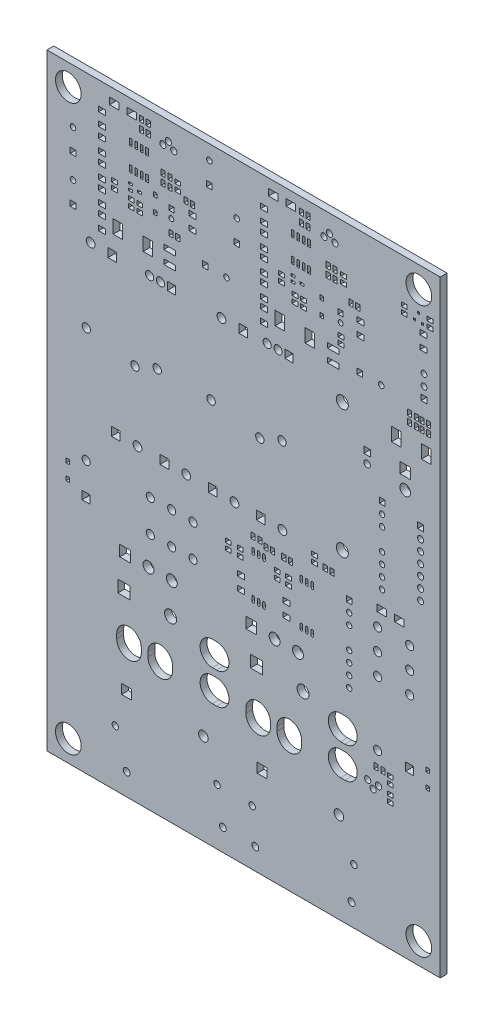
from build123d import *

# Parameters (mm, degrees)
MODEL_R            = 3
MODEL_R_2          = 0.79995
MODEL_R_3          = 0.75
MODEL_W            = 2.25
MODEL_H            = 2.25
MODEL_R_4          = 1.125
MODEL_W_2          = 2.8
MODEL_H_2          = 2.8
MODEL_W_3          = 2.55
MODEL_H_3          = 2.55
MODEL_W_4          = 0.8
MODEL_H_4          = 1
MODEL_W_5          = 1.9
MODEL_H_5          = 1.9
MODEL_R_5          = 0.95
MODEL_R_6          = 1.4
MODEL_R_7          = 1.275
MODEL_W_6          = 1.65
MODEL_H_6          = 1.15
MODEL_W_7          = 1.35
MODEL_H_7          = 0.95
MODEL_R_8          = 0.725
MODEL_W_8          = 0.95
MODEL_H_8          = 1.35
MODEL_R_9          = 0.625
MODEL_W_9          = 1.25
MODEL_H_9          = 1.25
MODEL_W_10         = 2.2
MODEL_H_10         = 1.55
MODEL_W_11         = 2.05
MODEL_H_11         = 2.05
MODEL_R_10         = 1.025
MODEL_R_11         = 0.975
MODEL_W_12         = 1.3
MODEL_H_12         = 1.3
MODEL_R_12         = 0.65
MODEL_H_13         = 3.15
MODEL_W_13         = 0.85
MODEL_H_14         = 0.55
MODEL_W_14         = 0.6
MODEL_W_15         = 2.7
MODEL_R_13         = 0.575
MODEL_W_16         = 1.15
MODEL_R_14         = 0.7
MODEL_W_17         = 1.5
MODEL_H_15         = 1.5
MODEL_R_15         = 1.25
MODEL_W_18         = 1.4
MODEL_H_16         = 1.4
MODEL_W_19         = 2.5
MODEL_H_17         = 2.5
MODEL_R_16         = 0.675
MODEL_W_20         = 0.4318
MODEL_H_18         = 0.508
BOSS_EXTRU_1_DEPTH = 1.6


with BuildPart() as part:
    # Model → Boss.-Extru.1 (new body)
    with BuildSketch(Plane.XY):
        Polygon((0, 136), (0, 0), (91, 0), (92, 0), (92, 136), (92, 142), (0, 142), align=None)
        with Locations((5, 5)):
            Circle(MODEL_R, mode=Mode.SUBTRACT)
        with Locations((18.65, 5.1)):
            Circle(MODEL_R_2, mode=Mode.SUBTRACT)
        with Locations((16, 13.1)):
            Circle(MODEL_R_3, mode=Mode.SUBTRACT)
        with Locations((18.6, 21.3)):
            Rectangle(MODEL_W, MODEL_H, mode=Mode.SUBTRACT)
        with BuildLine():
            ThreePointArc((22.075, 30.9), (19.2, 28.025), (16.325, 30.9))
            Line((16.325, 30.9), (16.325, 31.9))
            ThreePointArc((16.325, 31.9), (19.2, 34.775), (22.075, 31.9))
            Line((22.075, 31.9), (22.075, 30.9))
        make_face(mode=Mode.SUBTRACT)
        with Locations((41.15, 5.1)):
            Circle(MODEL_R_2, mode=Mode.SUBTRACT)
        with Locations((39.8, 13.1)):
            Circle(MODEL_R_3, mode=Mode.SUBTRACT)
        with BuildLine():
            ThreePointArc((29.375, 30.9), (26.5, 28.025), (23.625, 30.9))
            Line((23.625, 30.9), (23.625, 31.9))
            ThreePointArc((23.625, 31.9), (26.5, 34.775), (29.375, 31.9))
            Line((29.375, 31.9), (29.375, 30.9))
        make_face(mode=Mode.SUBTRACT)
        with Locations((36.6, 21.3)):
            Circle(MODEL_R_4, mode=Mode.SUBTRACT)
        with BuildLine():
            ThreePointArc((39.7, 34.675), (42.575, 31.8), (39.7, 28.925))
            Line((39.7, 28.925), (38.7, 28.925))
            ThreePointArc((38.7, 28.925), (35.825, 31.8), (38.7, 34.675))
            Line((38.7, 34.675), (39.7, 34.675))
        make_face(mode=Mode.SUBTRACT)
        with Locations((18, 41.7)):
            Rectangle(MODEL_W_2, MODEL_H_2, mode=Mode.SUBTRACT)
        with Locations((18.3, 49.1)):
            Rectangle(MODEL_W_3, MODEL_H_3, mode=Mode.SUBTRACT)
        with Locations((4.9, 57.5)):
            Rectangle(MODEL_W_4, MODEL_H_4, mode=Mode.SUBTRACT)
        with Locations((4.9, 61.1)):
            Rectangle(MODEL_W_4, MODEL_H_4, mode=Mode.SUBTRACT)
        with Locations((9.18, 55.95)):
            Rectangle(MODEL_W_5, MODEL_H_5, mode=Mode.SUBTRACT)
        with Locations((9.18, 63.45)):
            Circle(MODEL_R_5, mode=Mode.SUBTRACT)
        with Locations((28.92, 41.7)):
            Circle(MODEL_R_6, mode=Mode.SUBTRACT)
        with Locations((23.76, 49.1)):
            Circle(MODEL_R_7, mode=Mode.SUBTRACT)
        with Locations((29.22, 49.1)):
            Circle(MODEL_R_7, mode=Mode.SUBTRACT)
        with BuildLine():
            ThreePointArc((39.7, 41.975), (42.575, 39.1), (39.7, 36.225))
            Line((39.7, 36.225), (38.7, 36.225))
            ThreePointArc((38.7, 36.225), (35.825, 39.1), (38.7, 41.975))
            Line((38.7, 41.975), (39.7, 41.975))
        make_face(mode=Mode.SUBTRACT)
        with Locations((24.18, 55.95)):
            Circle(MODEL_R_5, mode=Mode.SUBTRACT)
        with Locations((29.18, 55.95)):
            Circle(MODEL_R_5, mode=Mode.SUBTRACT)
        with Locations((34.18, 55.95)):
            Circle(MODEL_R_5, mode=Mode.SUBTRACT)
        with Locations((24.18, 63.45)):
            Circle(MODEL_R_5, mode=Mode.SUBTRACT)
        with Locations((29.18, 63.45)):
            Circle(MODEL_R_5, mode=Mode.SUBTRACT)
        with Locations((34.18, 63.45)):
            Circle(MODEL_R_5, mode=Mode.SUBTRACT)
        with Locations((45.4, 55.3)):
            Rectangle(MODEL_W_6, MODEL_H_6, mode=Mode.SUBTRACT)
        with Locations((42.4, 62)):
            Rectangle(MODEL_W_7, MODEL_H_7, mode=Mode.SUBTRACT)
        with Locations((45.4, 58.3)):
            Rectangle(MODEL_W_6, MODEL_H_6, mode=Mode.SUBTRACT)
        with Locations((45.2, 62)):
            Rectangle(MODEL_W_7, MODEL_H_7, mode=Mode.SUBTRACT)
        with Locations((42.4, 63.6)):
            Rectangle(MODEL_W_7, MODEL_H_7, mode=Mode.SUBTRACT)
        with Locations((45.2, 63.6)):
            Rectangle(MODEL_W_7, MODEL_H_7, mode=Mode.SUBTRACT)
        with Locations((48.75, 5)):
            Circle(MODEL_R_2, mode=Mode.SUBTRACT)
        with Locations((48, 12.9)):
            Circle(MODEL_R_3, mode=Mode.SUBTRACT)
        with Locations((50.3, 21.2)):
            Rectangle(MODEL_W, MODEL_H, mode=Mode.SUBTRACT)
        with BuildLine():
            ThreePointArc((52.275, 30.9), (49.4, 28.025), (46.525, 30.9))
            Line((46.525, 30.9), (46.525, 31.9))
            ThreePointArc((46.525, 31.9), (49.4, 34.775), (52.275, 31.9))
            Line((52.275, 31.9), (52.275, 30.9))
        make_face(mode=Mode.SUBTRACT)
        with BuildLine():
            ThreePointArc((59.575, 30.9), (56.7, 28.025), (53.825, 30.9))
            Line((53.825, 30.9), (53.825, 31.9))
            ThreePointArc((53.825, 31.9), (56.7, 34.775), (59.575, 31.9))
            Line((59.575, 31.9), (59.575, 30.9))
        make_face(mode=Mode.SUBTRACT)
        with Locations((68.3, 21.2)):
            Circle(MODEL_R_4, mode=Mode.SUBTRACT)
        with Locations((71.25, 5)):
            Circle(MODEL_R_2, mode=Mode.SUBTRACT)
        with Locations((71.8, 12.9)):
            Circle(MODEL_R_3, mode=Mode.SUBTRACT)
        with Locations((87, 5)):
            Circle(MODEL_R, mode=Mode.SUBTRACT)
        with BuildLine():
            ThreePointArc((69.7, 34.675), (72.575, 31.8), (69.7, 28.925))
            Line((69.7, 28.925), (68.7, 28.925))
            ThreePointArc((68.7, 28.925), (65.825, 31.8), (68.7, 34.675))
            Line((68.7, 34.675), (69.7, 34.675))
        make_face(mode=Mode.SUBTRACT)
        with Locations((76.3, 30.43)):
            Circle(MODEL_R_8, mode=Mode.SUBTRACT)
        with Locations((80.3, 29.7)):
            Rectangle(MODEL_W_7, MODEL_H_7, mode=Mode.SUBTRACT)
        with Locations((75.03, 31.7)):
            Circle(MODEL_R_8, mode=Mode.SUBTRACT)
        with Locations((77.57, 31.7)):
            Circle(MODEL_R_8, mode=Mode.SUBTRACT)
        with Locations((77, 35.3)):
            Rectangle(MODEL_W_8, MODEL_H_8, mode=Mode.SUBTRACT)
        with Locations((80.3, 31.3)):
            Rectangle(MODEL_W_7, MODEL_H_7, mode=Mode.SUBTRACT)
        with Locations((78.6, 35.3)):
            Rectangle(MODEL_W_8, MODEL_H_8, mode=Mode.SUBTRACT)
        with Locations((80.3, 33.4)):
            Rectangle(MODEL_W_7, MODEL_H_7, mode=Mode.SUBTRACT)
        with Locations((80.3, 35)):
            Rectangle(MODEL_W_7, MODEL_H_7, mode=Mode.SUBTRACT)
        with Locations((49, 42)):
            Rectangle(MODEL_W_2, MODEL_H_2, mode=Mode.SUBTRACT)
        with Locations((47.8, 49.3)):
            Rectangle(MODEL_W_3, MODEL_H_3, mode=Mode.SUBTRACT)
        with Locations((53.26, 49.3)):
            Circle(MODEL_R_7, mode=Mode.SUBTRACT)
        with Locations((59.92, 42)):
            Circle(MODEL_R_6, mode=Mode.SUBTRACT)
        with Locations((58.72, 49.3)):
            Circle(MODEL_R_7, mode=Mode.SUBTRACT)
        with BuildLine():
            ThreePointArc((48.53, 54.375), (48.23, 54.075), (47.93, 54.375))
            Line((47.93, 54.375), (47.93, 55.325))
            ThreePointArc((47.93, 55.325), (48.23, 55.625), (48.53, 55.325))
            Line((48.53, 55.325), (48.53, 54.375))
        make_face(mode=Mode.SUBTRACT)
        with BuildLine():
            ThreePointArc((49.8, 54.375), (49.5, 54.075), (49.2, 54.375))
            Line((49.2, 54.375), (49.2, 55.325))
            ThreePointArc((49.2, 55.325), (49.5, 55.625), (49.8, 55.325))
            Line((49.8, 55.325), (49.8, 54.375))
        make_face(mode=Mode.SUBTRACT)
        with BuildLine():
            ThreePointArc((51.07, 54.375), (50.77, 54.075), (50.47, 54.375))
            Line((50.47, 54.375), (50.47, 55.325))
            ThreePointArc((50.47, 55.325), (50.77, 55.625), (51.07, 55.325))
            Line((51.07, 55.325), (51.07, 54.375))
        make_face(mode=Mode.SUBTRACT)
        with Locations((56, 55.2)):
            Rectangle(MODEL_W_6, MODEL_H_6, mode=Mode.SUBTRACT)
        with Locations((53.9, 61.8)):
            Rectangle(MODEL_W_7, MODEL_H_7, mode=Mode.SUBTRACT)
        with Locations((56, 58.2)):
            Rectangle(MODEL_W_6, MODEL_H_6, mode=Mode.SUBTRACT)
        with Locations((56.5, 61.8)):
            Rectangle(MODEL_W_7, MODEL_H_7, mode=Mode.SUBTRACT)
        with BuildLine():
            ThreePointArc((48.53, 64.075), (48.23, 63.775), (47.93, 64.075))
            Line((47.93, 64.075), (47.93, 65.025))
            ThreePointArc((47.93, 65.025), (48.23, 65.325), (48.53, 65.025))
            Line((48.53, 65.025), (48.53, 64.075))
        make_face(mode=Mode.SUBTRACT)
        with BuildLine():
            ThreePointArc((49.8, 64.075), (49.5, 63.775), (49.2, 64.075))
            Line((49.2, 64.075), (49.2, 65.025))
            ThreePointArc((49.2, 65.025), (49.5, 65.325), (49.8, 65.025))
            Line((49.8, 65.025), (49.8, 64.075))
        make_face(mode=Mode.SUBTRACT)
        with BuildLine():
            ThreePointArc((51.07, 64.075), (50.77, 63.775), (50.47, 64.075))
            Line((50.47, 64.075), (50.47, 65.025))
            ThreePointArc((50.47, 65.025), (50.77, 65.325), (51.07, 65.025))
            Line((51.07, 65.025), (51.07, 64.075))
        make_face(mode=Mode.SUBTRACT)
        with Locations((48.2, 67.6)):
            Rectangle(MODEL_W_8, MODEL_H_8, mode=Mode.SUBTRACT)
        with Locations((49.8, 67.6)):
            Rectangle(MODEL_W_8, MODEL_H_8, mode=Mode.SUBTRACT)
        with Locations((51.2, 66.9)):
            Rectangle(MODEL_W_8, MODEL_H_8, mode=Mode.SUBTRACT)
        with Locations((53.9, 63.4)):
            Rectangle(MODEL_W_7, MODEL_H_7, mode=Mode.SUBTRACT)
        with Locations((56.5, 63.4)):
            Rectangle(MODEL_W_7, MODEL_H_7, mode=Mode.SUBTRACT)
        with Locations((52.8, 66.9)):
            Rectangle(MODEL_W_8, MODEL_H_8, mode=Mode.SUBTRACT)
        with Locations((55.4, 66.9)):
            Rectangle(MODEL_W_8, MODEL_H_8, mode=Mode.SUBTRACT)
        with Locations((57, 66.9)):
            Rectangle(MODEL_W_8, MODEL_H_8, mode=Mode.SUBTRACT)
        with BuildLine():
            ThreePointArc((59.83, 54.375), (59.53, 54.075), (59.23, 54.375))
            Line((59.23, 54.375), (59.23, 55.325))
            ThreePointArc((59.23, 55.325), (59.53, 55.625), (59.83, 55.325))
            Line((59.83, 55.325), (59.83, 54.375))
        make_face(mode=Mode.SUBTRACT)
        with BuildLine():
            ThreePointArc((61.1, 54.375), (60.8, 54.075), (60.5, 54.375))
            Line((60.5, 54.375), (60.5, 55.325))
            ThreePointArc((60.5, 55.325), (60.8, 55.625), (61.1, 55.325))
            Line((61.1, 55.325), (61.1, 54.375))
        make_face(mode=Mode.SUBTRACT)
        with BuildLine():
            ThreePointArc((62.37, 54.375), (62.07, 54.075), (61.77, 54.375))
            Line((61.77, 54.375), (61.77, 55.325))
            ThreePointArc((61.77, 55.325), (62.07, 55.625), (62.37, 55.325))
            Line((62.37, 55.325), (62.37, 54.375))
        make_face(mode=Mode.SUBTRACT)
        with BuildLine():
            ThreePointArc((59.83, 64.075), (59.53, 63.775), (59.23, 64.075))
            Line((59.23, 64.075), (59.23, 65.025))
            ThreePointArc((59.23, 65.025), (59.53, 65.325), (59.83, 65.025))
            Line((59.83, 65.025), (59.83, 64.075))
        make_face(mode=Mode.SUBTRACT)
        with BuildLine():
            ThreePointArc((61.1, 64.075), (60.8, 63.775), (60.5, 64.075))
            Line((60.5, 64.075), (60.5, 65.025))
            ThreePointArc((60.5, 65.025), (60.8, 65.325), (61.1, 65.025))
            Line((61.1, 65.025), (61.1, 64.075))
        make_face(mode=Mode.SUBTRACT)
        with BuildLine():
            ThreePointArc((62.37, 64.075), (62.07, 63.775), (61.77, 64.075))
            Line((61.77, 64.075), (61.77, 65.025))
            ThreePointArc((61.77, 65.025), (62.07, 65.325), (62.37, 65.025))
            Line((62.37, 65.025), (62.37, 64.075))
        make_face(mode=Mode.SUBTRACT)
        with Locations((62.6, 69.4)):
            Rectangle(MODEL_W_7, MODEL_H_7, mode=Mode.SUBTRACT)
        with Locations((62.6, 71)):
            Rectangle(MODEL_W_7, MODEL_H_7, mode=Mode.SUBTRACT)
        with Locations((65.1, 69.6)):
            Rectangle(MODEL_W_8, MODEL_H_8, mode=Mode.SUBTRACT)
        with Locations((66.7, 69.6)):
            Rectangle(MODEL_W_8, MODEL_H_8, mode=Mode.SUBTRACT)
        with BuildLine():
            ThreePointArc((69.7, 41.975), (72.575, 39.1), (69.7, 36.225))
            Line((69.7, 36.225), (68.7, 36.225))
            ThreePointArc((68.7, 36.225), (65.825, 39.1), (68.7, 41.975))
            Line((68.7, 41.975), (69.7, 41.975))
        make_face(mode=Mode.SUBTRACT)
        with Locations((77.35, 38.78)):
            Circle(MODEL_R_5, mode=Mode.SUBTRACT)
        with Locations((70.7, 48.12)):
            Circle(MODEL_R_9, mode=Mode.SUBTRACT)
        with Locations((70.7, 50.66)):
            Circle(MODEL_R_9, mode=Mode.SUBTRACT)
        with Locations((70.7, 53.2)):
            Circle(MODEL_R_9, mode=Mode.SUBTRACT)
        with Locations((84.85, 38.78)):
            Rectangle(MODEL_W_5, MODEL_H_5, mode=Mode.SUBTRACT)
        with Locations((89.1, 37)):
            Rectangle(MODEL_W_4, MODEL_H_4, mode=Mode.SUBTRACT)
        with Locations((89.1, 40.6)):
            Rectangle(MODEL_W_4, MODEL_H_4, mode=Mode.SUBTRACT)
        with Locations((70.7, 55.74)):
            Circle(MODEL_R_9, mode=Mode.SUBTRACT)
        with Locations((70.7, 60.82)):
            Circle(MODEL_R_9, mode=Mode.SUBTRACT)
        with Locations((77.35, 53.78)):
            Circle(MODEL_R_5, mode=Mode.SUBTRACT)
        with Locations((77.35, 58.78)):
            Circle(MODEL_R_5, mode=Mode.SUBTRACT)
        with Locations((70.7, 63.36)):
            Circle(MODEL_R_9, mode=Mode.SUBTRACT)
        with Locations((70.7, 65.9)):
            Rectangle(MODEL_W_9, MODEL_H_9, mode=Mode.SUBTRACT)
        with Locations((77.35, 63.78)):
            Circle(MODEL_R_5, mode=Mode.SUBTRACT)
        with Locations((78.35, 67.6)):
            Rectangle(MODEL_W_10, MODEL_H_10, mode=Mode.SUBTRACT)
        with Locations((84.85, 53.78)):
            Circle(MODEL_R_5, mode=Mode.SUBTRACT)
        with Locations((84.85, 58.78)):
            Circle(MODEL_R_5, mode=Mode.SUBTRACT)
        with Locations((84.85, 63.78)):
            Circle(MODEL_R_5, mode=Mode.SUBTRACT)
        with Locations((82.45, 67.6)):
            Rectangle(MODEL_W_10, MODEL_H_10, mode=Mode.SUBTRACT)
        with Locations((16.1, 72.3)):
            Rectangle(MODEL_W_11, MODEL_H_11, mode=Mode.SUBTRACT)
        with Locations((21.18, 72.3)):
            Circle(MODEL_R_10, mode=Mode.SUBTRACT)
        with Locations((20.6, 88.281)):
            Circle(MODEL_R_11, mode=Mode.SUBTRACT)
        with Locations((9.21, 90.3)):
            Circle(MODEL_R_11, mode=Mode.SUBTRACT)
        with Locations((27.5, 72.3)):
            Rectangle(MODEL_W_11, MODEL_H_11, mode=Mode.SUBTRACT)
        with Locations((32.58, 72.3)):
            Circle(MODEL_R_10, mode=Mode.SUBTRACT)
        with Locations((38.8, 72.3)):
            Rectangle(MODEL_W_11, MODEL_H_11, mode=Mode.SUBTRACT)
        with Locations((43.88, 72.3)):
            Circle(MODEL_R_10, mode=Mode.SUBTRACT)
        with Locations((25.794, 90.3)):
            Circle(MODEL_R_11, mode=Mode.SUBTRACT)
        with Locations((38.41, 90.3)):
            Circle(MODEL_R_11, mode=Mode.SUBTRACT)
        with Locations((10.22, 108.1)):
            Circle(MODEL_R_10, mode=Mode.SUBTRACT)
        with Locations((6.1, 113.7)):
            Rectangle(MODEL_W_12, MODEL_H_12, mode=Mode.SUBTRACT)
        with Locations((6.1, 118.7)):
            Circle(MODEL_R_12, mode=Mode.SUBTRACT)
        with Locations((15.3, 108.1)):
            Rectangle(MODEL_W_11, MODEL_H_11, mode=Mode.SUBTRACT)
        with Locations((12.9, 112)):
            Rectangle(MODEL_W_6, MODEL_H_6, mode=Mode.SUBTRACT)
        with Locations((12.9, 115)):
            Rectangle(MODEL_W_6, MODEL_H_6, mode=Mode.SUBTRACT)
        with Locations((16.6, 114)):
            Rectangle(MODEL_W_10, MODEL_H_13, mode=Mode.SUBTRACT)
        with Locations((12.9, 117.2)):
            Rectangle(MODEL_W_6, MODEL_H_6, mode=Mode.SUBTRACT)
        with Locations((12.9, 120.2)):
            Rectangle(MODEL_W_6, MODEL_H_6, mode=Mode.SUBTRACT)
        with Locations((12.9, 122.4)):
            Rectangle(MODEL_W_6, MODEL_H_6, mode=Mode.SUBTRACT)
        with Locations((15.8, 121.7)):
            Rectangle(MODEL_W_7, MODEL_H_7, mode=Mode.SUBTRACT)
        with Locations((15.8, 123.3)):
            Rectangle(MODEL_W_7, MODEL_H_7, mode=Mode.SUBTRACT)
        with Locations((19.7, 120)):
            Rectangle(MODEL_W_7, MODEL_H_7, mode=Mode.SUBTRACT)
        with Locations((19.7, 121.6)):
            Rectangle(MODEL_W_7, MODEL_H_7, mode=Mode.SUBTRACT)
        with Locations((19.55, 123.35)):
            Rectangle(MODEL_W_13, MODEL_H_14, mode=Mode.SUBTRACT)
        with Locations((21.7, 120)):
            Rectangle(MODEL_W_7, MODEL_H_7, mode=Mode.SUBTRACT)
        with Locations((21.7, 121.6)):
            Rectangle(MODEL_W_7, MODEL_H_7, mode=Mode.SUBTRACT)
        with Locations((21.65, 124)):
            Rectangle(MODEL_W_13, MODEL_H_14, mode=Mode.SUBTRACT)
        with Locations((6.1, 124.4)):
            Rectangle(MODEL_W_12, MODEL_H_12, mode=Mode.SUBTRACT)
        with Locations((6.1, 129.4)):
            Circle(MODEL_R_12, mode=Mode.SUBTRACT)
        with Locations((5, 137)):
            Circle(MODEL_R, mode=Mode.SUBTRACT)
        with Locations((12.9, 125.4)):
            Rectangle(MODEL_W_6, MODEL_H_6, mode=Mode.SUBTRACT)
        with Locations((12.9, 127.7)):
            Rectangle(MODEL_W_6, MODEL_H_6, mode=Mode.SUBTRACT)
        with Locations((12.9, 130.7)):
            Rectangle(MODEL_W_6, MODEL_H_6, mode=Mode.SUBTRACT)
        with Locations((12.9, 133.1)):
            Rectangle(MODEL_W_6, MODEL_H_6, mode=Mode.SUBTRACT)
        with Locations((19.55, 124.65)):
            Rectangle(MODEL_W_13, MODEL_H_14, mode=Mode.SUBTRACT)
        with Locations((19.595, 127.7)):
            Rectangle(MODEL_W_14, MODEL_H_10, mode=Mode.SUBTRACT)
        with Locations((20.865, 127.7)):
            Rectangle(MODEL_W_14, MODEL_H_10, mode=Mode.SUBTRACT)
        with Locations((22.135, 127.7)):
            Rectangle(MODEL_W_14, MODEL_H_10, mode=Mode.SUBTRACT)
        with Locations((19.595, 133.1)):
            Rectangle(MODEL_W_14, MODEL_H_10, mode=Mode.SUBTRACT)
        with Locations((20.865, 133.1)):
            Rectangle(MODEL_W_14, MODEL_H_10, mode=Mode.SUBTRACT)
        with Locations((22.135, 133.1)):
            Rectangle(MODEL_W_14, MODEL_H_10, mode=Mode.SUBTRACT)
        with Locations((12.9, 136.1)):
            Rectangle(MODEL_W_6, MODEL_H_6, mode=Mode.SUBTRACT)
        with Locations((15.75, 139)):
            Rectangle(MODEL_W_10, MODEL_H_10, mode=Mode.SUBTRACT)
        with Locations((22.1, 136.9)):
            Rectangle(MODEL_W_8, MODEL_H_8, mode=Mode.SUBTRACT)
        with Locations((19.85, 139)):
            Rectangle(MODEL_W_10, MODEL_H_10, mode=Mode.SUBTRACT)
        with Locations((22.1, 139)):
            Rectangle(MODEL_W_8, MODEL_H_8, mode=Mode.SUBTRACT)
        with Locations((24.02, 108.3)):
            Circle(MODEL_R_5, mode=Mode.SUBTRACT)
        with Locations((26.56, 108.3)):
            Circle(MODEL_R_5, mode=Mode.SUBTRACT)
        with Locations((23.6, 114)):
            Rectangle(MODEL_W_10, MODEL_H_13, mode=Mode.SUBTRACT)
        with Locations((28.7, 112.8)):
            Rectangle(MODEL_W_15, MODEL_H_6, mode=Mode.SUBTRACT)
        with Locations((29.1, 108.3)):
            Rectangle(MODEL_W_5, MODEL_H_5, mode=Mode.SUBTRACT)
        with Locations((28.7, 115.8)):
            Rectangle(MODEL_W_15, MODEL_H_6, mode=Mode.SUBTRACT)
        with Locations((25.3, 121.7)):
            Rectangle(MODEL_W_4, MODEL_H_4, mode=Mode.SUBTRACT)
        with Locations((29, 119.3)):
            Rectangle(MODEL_W_8, MODEL_H_8, mode=Mode.SUBTRACT)
        with Locations((30.6, 119.3)):
            Rectangle(MODEL_W_8, MODEL_H_8, mode=Mode.SUBTRACT)
        with Locations((29.1, 122.4)):
            Circle(MODEL_R_13, mode=Mode.SUBTRACT)
        with Locations((34.1, 122.6)):
            Rectangle(MODEL_W_6, MODEL_H_6, mode=Mode.SUBTRACT)
        with Locations((40.82, 108.1)):
            Circle(MODEL_R_10, mode=Mode.SUBTRACT)
        with Locations((45.9, 108.1)):
            Rectangle(MODEL_W_11, MODEL_H_11, mode=Mode.SUBTRACT)
        with Locations((37, 116.9)):
            Rectangle(MODEL_W_12, MODEL_H_12, mode=Mode.SUBTRACT)
        with Locations((42, 116.9)):
            Circle(MODEL_R_12, mode=Mode.SUBTRACT)
        with Locations((25.3, 125.3)):
            Rectangle(MODEL_W_4, MODEL_H_4, mode=Mode.SUBTRACT)
        with Locations((23.405, 127.7)):
            Rectangle(MODEL_W_14, MODEL_H_10, mode=Mode.SUBTRACT)
        with Locations((27.2, 128.6)):
            Rectangle(MODEL_W_8, MODEL_H_8, mode=Mode.SUBTRACT)
        with Locations((23.405, 133.1)):
            Rectangle(MODEL_W_14, MODEL_H_10, mode=Mode.SUBTRACT)
        with Locations((27.2, 130.6)):
            Rectangle(MODEL_W_8, MODEL_H_8, mode=Mode.SUBTRACT)
        with Locations((29.1, 124.4)):
            Rectangle(MODEL_W_16, MODEL_H_6, mode=Mode.SUBTRACT)
        with Locations((28.8, 128.6)):
            Rectangle(MODEL_W_8, MODEL_H_8, mode=Mode.SUBTRACT)
        with Locations((34.1, 125.6)):
            Rectangle(MODEL_W_6, MODEL_H_6, mode=Mode.SUBTRACT)
        with Locations((32.5, 127.7)):
            Rectangle(MODEL_W_8, MODEL_H_8, mode=Mode.SUBTRACT)
        with Locations((34.1, 127.7)):
            Rectangle(MODEL_W_8, MODEL_H_8, mode=Mode.SUBTRACT)
        with Locations((28.8, 130.6)):
            Rectangle(MODEL_W_8, MODEL_H_8, mode=Mode.SUBTRACT)
        with Locations((30.6, 128.8)):
            Rectangle(MODEL_W_7, MODEL_H_7, mode=Mode.SUBTRACT)
        with Locations((30.6, 130.4)):
            Rectangle(MODEL_W_7, MODEL_H_7, mode=Mode.SUBTRACT)
        with Locations((23.7, 136.9)):
            Rectangle(MODEL_W_8, MODEL_H_8, mode=Mode.SUBTRACT)
        with Locations((27.13, 136.4)):
            Circle(MODEL_R_8, mode=Mode.SUBTRACT)
        with Locations((23.7, 139)):
            Rectangle(MODEL_W_8, MODEL_H_8, mode=Mode.SUBTRACT)
        with Locations((28.4, 137.67)):
            Circle(MODEL_R_8, mode=Mode.SUBTRACT)
        with Locations((29.67, 136.4)):
            Circle(MODEL_R_8, mode=Mode.SUBTRACT)
        with Locations((44.4, 125.1)):
            Rectangle(MODEL_W_12, MODEL_H_12, mode=Mode.SUBTRACT)
        with Locations((44.4, 130.1)):
            Circle(MODEL_R_12, mode=Mode.SUBTRACT)
        with Locations((38, 133.6)):
            Rectangle(MODEL_W_12, MODEL_H_12, mode=Mode.SUBTRACT)
        with Locations((38, 138.6)):
            Circle(MODEL_R_12, mode=Mode.SUBTRACT)
        with Locations((50, 72.3)):
            Rectangle(MODEL_W_11, MODEL_H_11, mode=Mode.SUBTRACT)
        with Locations((55.08, 72.3)):
            Circle(MODEL_R_10, mode=Mode.SUBTRACT)
        with Locations((49.8, 88.281)):
            Circle(MODEL_R_11, mode=Mode.SUBTRACT)
        with Locations((54.994, 90.3)):
            Circle(MODEL_R_11, mode=Mode.SUBTRACT)
        with Locations((69.1, 75.2)):
            Circle(MODEL_R_6, mode=Mode.SUBTRACT)
        with Locations((78.4, 71.92)):
            Circle(MODEL_R_9, mode=Mode.SUBTRACT)
        with Locations((78.4, 74.46)):
            Circle(MODEL_R_9, mode=Mode.SUBTRACT)
        with Locations((78.4, 77)):
            Circle(MODEL_R_9, mode=Mode.SUBTRACT)
        with Locations((78.4, 79.54)):
            Circle(MODEL_R_9, mode=Mode.SUBTRACT)
        with Locations((78.4, 84.62)):
            Circle(MODEL_R_9, mode=Mode.SUBTRACT)
        with Locations((78.4, 87.16)):
            Circle(MODEL_R_9, mode=Mode.SUBTRACT)
        with Locations((87.4, 74.1)):
            Circle(MODEL_R_14, mode=Mode.SUBTRACT)
        with Locations((87.4, 76.6)):
            Circle(MODEL_R_14, mode=Mode.SUBTRACT)
        with Locations((87.4, 79.1)):
            Circle(MODEL_R_14, mode=Mode.SUBTRACT)
        with Locations((87.4, 81.6)):
            Circle(MODEL_R_14, mode=Mode.SUBTRACT)
        with Locations((87.4, 84.1)):
            Circle(MODEL_R_14, mode=Mode.SUBTRACT)
        with Locations((87.4, 86.6)):
            Circle(MODEL_R_14, mode=Mode.SUBTRACT)
        with Locations((78.4, 89.7)):
            Rectangle(MODEL_W_9, MODEL_H_9, mode=Mode.SUBTRACT)
        with Locations((74.9, 95.6)):
            Circle(MODEL_R_3, mode=Mode.SUBTRACT)
        with Locations((69.1, 105.2)):
            Circle(MODEL_R_6, mode=Mode.SUBTRACT)
        with Locations((74.9, 98.1)):
            Rectangle(MODEL_W_17, MODEL_H_15, mode=Mode.SUBTRACT)
        with Locations((83.8, 94.74)):
            Circle(MODEL_R_15, mode=Mode.SUBTRACT)
        with Locations((87.4, 89.1)):
            Rectangle(MODEL_W_18, MODEL_H_16, mode=Mode.SUBTRACT)
        with Locations((83.8, 98.7)):
            Rectangle(MODEL_W_19, MODEL_H_17, mode=Mode.SUBTRACT)
        with Locations((81.7, 104.5)):
            Rectangle(MODEL_W_10, MODEL_H_13, mode=Mode.SUBTRACT)
        with Locations((88.7, 104.5)):
            Rectangle(MODEL_W_10, MODEL_H_13, mode=Mode.SUBTRACT)
        with Locations((51.52, 108.3)):
            Circle(MODEL_R_5, mode=Mode.SUBTRACT)
        with Locations((50.8, 112.1)):
            Rectangle(MODEL_W_6, MODEL_H_6, mode=Mode.SUBTRACT)
        with Locations((50.8, 115.1)):
            Rectangle(MODEL_W_6, MODEL_H_6, mode=Mode.SUBTRACT)
        with Locations((54.06, 108.3)):
            Circle(MODEL_R_5, mode=Mode.SUBTRACT)
        with Locations((56.6, 108.3)):
            Rectangle(MODEL_W_5, MODEL_H_5, mode=Mode.SUBTRACT)
        with Locations((54.5, 114.4)):
            Rectangle(MODEL_W_10, MODEL_H_13, mode=Mode.SUBTRACT)
        with Locations((50.8, 117.1)):
            Rectangle(MODEL_W_6, MODEL_H_6, mode=Mode.SUBTRACT)
        with Locations((50.8, 120.1)):
            Rectangle(MODEL_W_6, MODEL_H_6, mode=Mode.SUBTRACT)
        with Locations((50.8, 122.2)):
            Rectangle(MODEL_W_6, MODEL_H_6, mode=Mode.SUBTRACT)
        with Locations((54.9, 122.4)):
            Rectangle(MODEL_W_7, MODEL_H_7, mode=Mode.SUBTRACT)
        with Locations((54.9, 124)):
            Rectangle(MODEL_W_7, MODEL_H_7, mode=Mode.SUBTRACT)
        with Locations((61.5, 114.4)):
            Rectangle(MODEL_W_10, MODEL_H_13, mode=Mode.SUBTRACT)
        with Locations((67, 112)):
            Rectangle(MODEL_W_15, MODEL_H_6, mode=Mode.SUBTRACT)
        with Locations((67, 115)):
            Rectangle(MODEL_W_15, MODEL_H_6, mode=Mode.SUBTRACT)
        with Locations((58, 119.8)):
            Rectangle(MODEL_W_7, MODEL_H_7, mode=Mode.SUBTRACT)
        with Locations((60, 119.8)):
            Rectangle(MODEL_W_7, MODEL_H_7, mode=Mode.SUBTRACT)
        with Locations((58, 121.4)):
            Rectangle(MODEL_W_7, MODEL_H_7, mode=Mode.SUBTRACT)
        with Locations((60, 121.4)):
            Rectangle(MODEL_W_7, MODEL_H_7, mode=Mode.SUBTRACT)
        with Locations((57.55, 123.75)):
            Rectangle(MODEL_W_13, MODEL_H_14, mode=Mode.SUBTRACT)
        with Locations((68.8, 116.8)):
            Rectangle(MODEL_W_7, MODEL_H_7, mode=Mode.SUBTRACT)
        with Locations((68.8, 118.4)):
            Rectangle(MODEL_W_7, MODEL_H_7, mode=Mode.SUBTRACT)
        with Locations((64.3, 120.3)):
            Rectangle(MODEL_W_4, MODEL_H_4, mode=Mode.SUBTRACT)
        with Locations((64.3, 123.9)):
            Rectangle(MODEL_W_4, MODEL_H_4, mode=Mode.SUBTRACT)
        with Locations((68.7, 121.1)):
            Circle(MODEL_R_13, mode=Mode.SUBTRACT)
        with Locations((68.7, 123.1)):
            Rectangle(MODEL_W_16, MODEL_H_6, mode=Mode.SUBTRACT)
        with Locations((50.8, 125.2)):
            Rectangle(MODEL_W_6, MODEL_H_6, mode=Mode.SUBTRACT)
        with Locations((50.8, 127.2)):
            Rectangle(MODEL_W_6, MODEL_H_6, mode=Mode.SUBTRACT)
        with Locations((50.8, 130.2)):
            Rectangle(MODEL_W_6, MODEL_H_6, mode=Mode.SUBTRACT)
        with Locations((50.8, 132.4)):
            Rectangle(MODEL_W_6, MODEL_H_6, mode=Mode.SUBTRACT)
        with Locations((57.495, 128.1)):
            Rectangle(MODEL_W_14, MODEL_H_10, mode=Mode.SUBTRACT)
        with Locations((50.8, 135.4)):
            Rectangle(MODEL_W_6, MODEL_H_6, mode=Mode.SUBTRACT)
        with Locations((57.495, 133.5)):
            Rectangle(MODEL_W_14, MODEL_H_10, mode=Mode.SUBTRACT)
        with Locations((52.95, 139.1)):
            Rectangle(MODEL_W_10, MODEL_H_10, mode=Mode.SUBTRACT)
        with Locations((57.05, 139.1)):
            Rectangle(MODEL_W_10, MODEL_H_10, mode=Mode.SUBTRACT)
        with Locations((57.55, 125.05)):
            Rectangle(MODEL_W_13, MODEL_H_14, mode=Mode.SUBTRACT)
        with Locations((59.65, 124.4)):
            Rectangle(MODEL_W_13, MODEL_H_14, mode=Mode.SUBTRACT)
        with Locations((58.765, 128.1)):
            Rectangle(MODEL_W_14, MODEL_H_10, mode=Mode.SUBTRACT)
        with Locations((60.035, 128.1)):
            Rectangle(MODEL_W_14, MODEL_H_10, mode=Mode.SUBTRACT)
        with Locations((61.305, 128.1)):
            Rectangle(MODEL_W_14, MODEL_H_10, mode=Mode.SUBTRACT)
        with Locations((65.8, 129.2)):
            Rectangle(MODEL_W_8, MODEL_H_8, mode=Mode.SUBTRACT)
        with Locations((65.8, 131.2)):
            Rectangle(MODEL_W_8, MODEL_H_8, mode=Mode.SUBTRACT)
        with Locations((67.4, 129.2)):
            Rectangle(MODEL_W_8, MODEL_H_8, mode=Mode.SUBTRACT)
        with Locations((67.4, 131.2)):
            Rectangle(MODEL_W_8, MODEL_H_8, mode=Mode.SUBTRACT)
        with Locations((58.765, 133.5)):
            Rectangle(MODEL_W_14, MODEL_H_10, mode=Mode.SUBTRACT)
        with Locations((60.035, 133.5)):
            Rectangle(MODEL_W_14, MODEL_H_10, mode=Mode.SUBTRACT)
        with Locations((59.5, 136.7)):
            Rectangle(MODEL_W_8, MODEL_H_8, mode=Mode.SUBTRACT)
        with Locations((61.305, 133.5)):
            Rectangle(MODEL_W_14, MODEL_H_10, mode=Mode.SUBTRACT)
        with Locations((61.1, 136.7)):
            Rectangle(MODEL_W_8, MODEL_H_8, mode=Mode.SUBTRACT)
        with Locations((59.5, 138.9)):
            Rectangle(MODEL_W_8, MODEL_H_8, mode=Mode.SUBTRACT)
        with Locations((61.1, 138.9)):
            Rectangle(MODEL_W_8, MODEL_H_8, mode=Mode.SUBTRACT)
        with Locations((64.83, 136.6)):
            Circle(MODEL_R_8, mode=Mode.SUBTRACT)
        with Locations((67.37, 136.6)):
            Circle(MODEL_R_8, mode=Mode.SUBTRACT)
        with Locations((66.1, 137.87)):
            Circle(MODEL_R_8, mode=Mode.SUBTRACT)
        with Locations((73.2, 113.2)):
            Rectangle(MODEL_W_12, MODEL_H_12, mode=Mode.SUBTRACT)
        with Locations((78.2, 113.2)):
            Circle(MODEL_R_12, mode=Mode.SUBTRACT)
        with Locations((73.4, 120.7)):
            Rectangle(MODEL_W_6, MODEL_H_6, mode=Mode.SUBTRACT)
        with Locations((73.4, 123.7)):
            Rectangle(MODEL_W_6, MODEL_H_6, mode=Mode.SUBTRACT)
        with Locations((84.8, 108.9)):
            Rectangle(MODEL_W_8, MODEL_H_8, mode=Mode.SUBTRACT)
        with Locations((84.8, 110.8)):
            Rectangle(MODEL_W_8, MODEL_H_8, mode=Mode.SUBTRACT)
        with Locations((86.4, 108.9)):
            Rectangle(MODEL_W_8, MODEL_H_8, mode=Mode.SUBTRACT)
        with Locations((86.4, 110.8)):
            Rectangle(MODEL_W_8, MODEL_H_8, mode=Mode.SUBTRACT)
        with Locations((87.7, 108.9)):
            Rectangle(MODEL_W_8, MODEL_H_8, mode=Mode.SUBTRACT)
        with Locations((87.7, 110.8)):
            Rectangle(MODEL_W_8, MODEL_H_8, mode=Mode.SUBTRACT)
        with Locations((89.3, 108.9)):
            Rectangle(MODEL_W_8, MODEL_H_8, mode=Mode.SUBTRACT)
        with Locations((89.3, 110.8)):
            Rectangle(MODEL_W_8, MODEL_H_8, mode=Mode.SUBTRACT)
        with Locations((88.2, 115.4)):
            Rectangle(MODEL_W_7, MODEL_H_8, mode=Mode.SUBTRACT)
        with Locations((88.2, 117.94)):
            Circle(MODEL_R_16, mode=Mode.SUBTRACT)
        with Locations((88.2, 120.48)):
            Circle(MODEL_R_16, mode=Mode.SUBTRACT)
        with Locations((71.1, 126.3)):
            Rectangle(MODEL_W_8, MODEL_H_8, mode=Mode.SUBTRACT)
        with Locations((72.7, 126.3)):
            Rectangle(MODEL_W_8, MODEL_H_8, mode=Mode.SUBTRACT)
        with Locations((69.4, 129.4)):
            Rectangle(MODEL_W_7, MODEL_H_7, mode=Mode.SUBTRACT)
        with Locations((69.4, 131)):
            Rectangle(MODEL_W_7, MODEL_H_7, mode=Mode.SUBTRACT)
        with Locations((83.6, 130.4)):
            Rectangle(MODEL_W_7, MODEL_H_7, mode=Mode.SUBTRACT)
        with Locations((85.9602, 130.411)):
            Rectangle(MODEL_W_20, MODEL_H_18, mode=Mode.SUBTRACT)
        with Locations((83.6, 132)):
            Rectangle(MODEL_W_7, MODEL_H_7, mode=Mode.SUBTRACT)
        with Locations((88.1, 125.5)):
            Rectangle(MODEL_W_6, MODEL_H_6, mode=Mode.SUBTRACT)
        with Locations((88.1, 128.5)):
            Rectangle(MODEL_W_6, MODEL_H_6, mode=Mode.SUBTRACT)
        with Locations((87.8652, 130.411)):
            Rectangle(MODEL_W_20, MODEL_H_18, mode=Mode.SUBTRACT)
        with Locations((86.9, 132.189)):
            Rectangle(MODEL_W_20, MODEL_H_18, mode=Mode.SUBTRACT)
        with Locations((89.6, 130.5)):
            Rectangle(MODEL_W_7, MODEL_H_7, mode=Mode.SUBTRACT)
        with Locations((89.6, 132.1)):
            Rectangle(MODEL_W_7, MODEL_H_7, mode=Mode.SUBTRACT)
        with Locations((87, 137)):
            Circle(MODEL_R, mode=Mode.SUBTRACT)
    extrude(amount=BOSS_EXTRU_1_DEPTH)


solid = part.part
